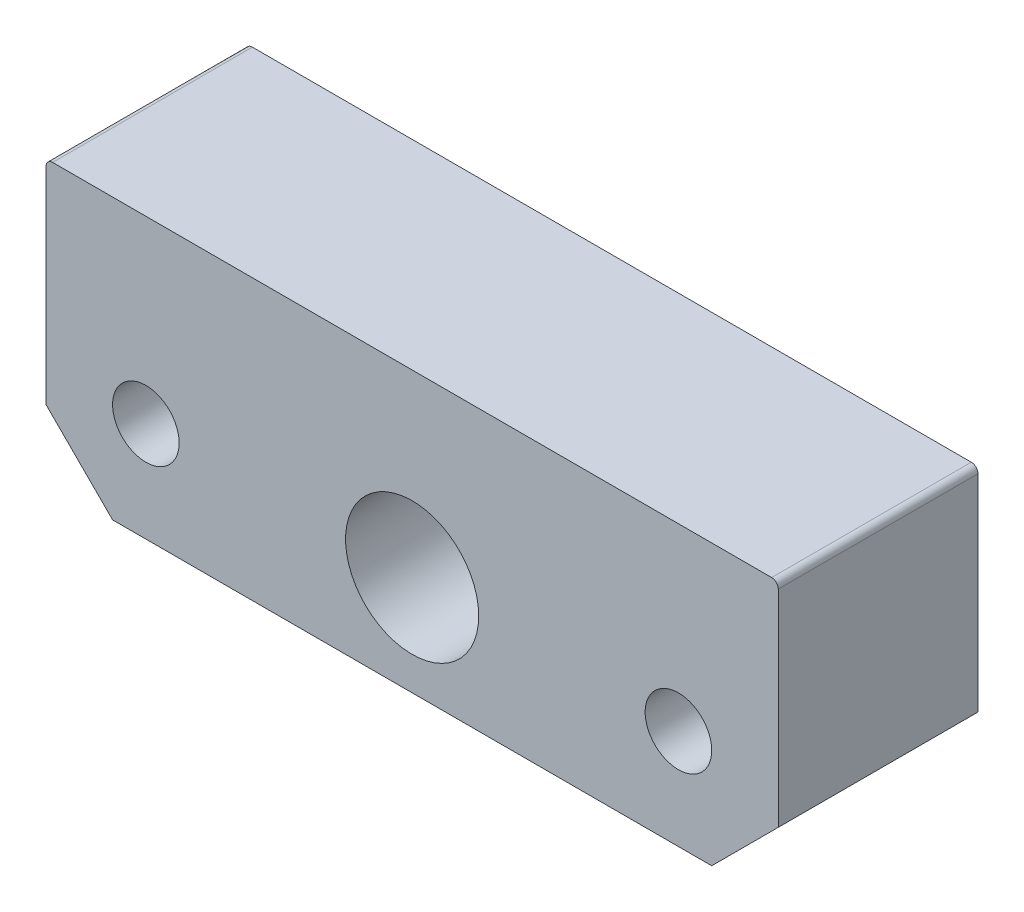
from build123d import *

# Parameters (mm, degrees)
CROQUIS1_W              = 110
CROQUIS1_H              = 42
SALIENTE_EXTRUIR1_DEPTH = 30
CHAFL_N1_SIZE           = 10
REDONDEO1_R             = 1
CROQUIS2_R              = 5
CROQUIS2_R_2            = 10
CORTAR_EXTRUIR1_DEPTH   = 30


with BuildPart() as part:
    # Croquis1 → Saliente-Extruir1 (new body)
    with BuildSketch(Plane.XY):
        Rectangle(CROQUIS1_W, CROQUIS1_H)
    extrude(amount=SALIENTE_EXTRUIR1_DEPTH)

    # Chaflán1
    chafl_n1_edges = [part.edges().sort_by_distance(p)[0] for p in [
        (-55, -21, 15),
        (55, -21, 15),
    ]]
    chamfer(chafl_n1_edges, length=CHAFL_N1_SIZE)

    # Redondeo1
    redondeo1_edges = [part.edges().sort_by_distance(p)[0] for p in [
        (-55, 21, 15),
        (55, 21, 15),
    ]]
    fillet(redondeo1_edges, radius=REDONDEO1_R)

    # Croquis2 → Cortar-Extruir1 (cut)
    with BuildSketch(Plane.XY.offset(30)):
        with Locations((-40, -6)):
            Circle(CROQUIS2_R)
        with Locations((40, -6)):
            Circle(CROQUIS2_R)
        with Locations((0, -6)):
            Circle(CROQUIS2_R_2)
    extrude(amount=-CORTAR_EXTRUIR1_DEPTH, mode=Mode.SUBTRACT)


solid = part.part
